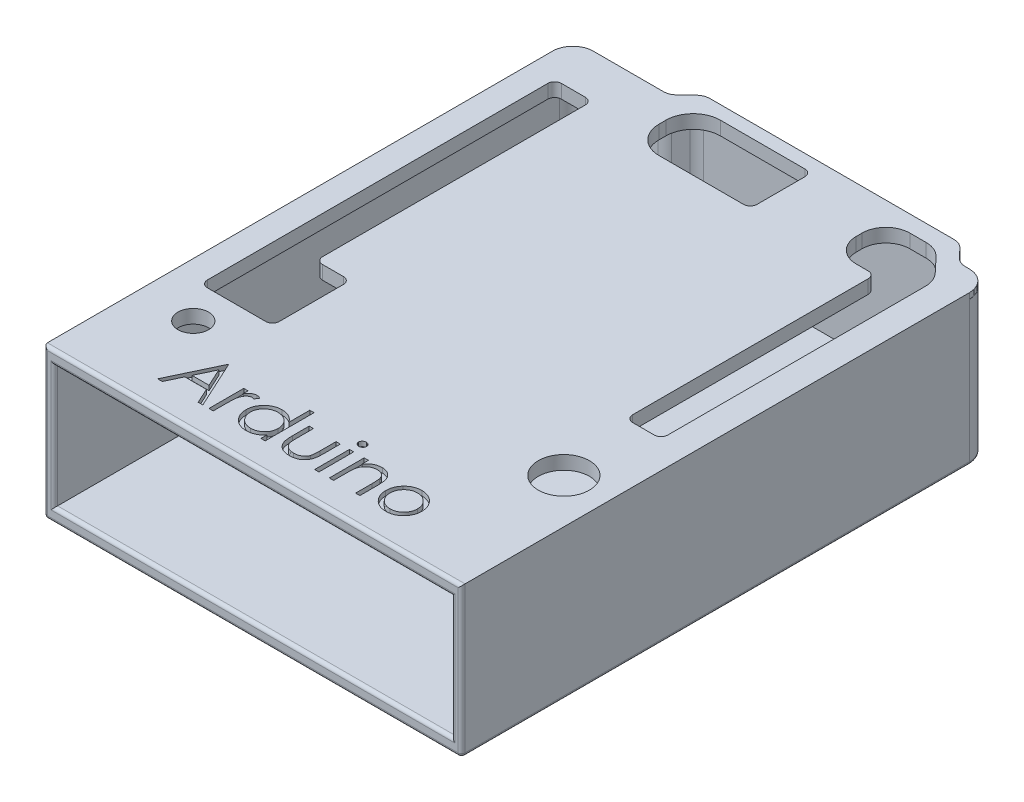
from build123d import *
from build123d.topology import SkipClean

# Parameters (mm, degrees)
SKETCH1_W                = 70
SKETCH1_H                = 100
BOSS_EXTRUDE1_DEPTH      = 2
CUT_EXTRUDE1_DEPTH       = 10
SKETCH3_W                = 95.720729794
SKETCH3_H                = 12.847627562
CUT_EXTRUDE2_DEPTH       = 10
CUT_EXTRUDE3_DEPTH       = 10
SKETCH5_R                = 2.00093218
CUT_EXTRUDE4_DEPTH       = 10
BOSS_EXTRUDE2_START      = 4.5
SKETCH6_R                = 2.75
SKETCH6_R_2              = 2.00093218
BOSS_EXTRUDE2_DEPTH      = 4.5
BOSS_EXTRUDE3_DEPTH      = 15
BOSS_EXTRUDE3_DEPTH_BACK = 6.5
SKETCH7_W                = 58.34
SKETCH7_H                = 1.5
SKETCH8_W                = 1.5
SKETCH8_H                = 75.08
BOSS_EXTRUDE4_DEPTH      = 22
CUT_EXTRUDE5_DEPTH       = 42
CUT_EXTRUDE5_DEPTH_BACK  = 62
SKETCH9_W                = 84.196128198
SKETCH9_H                = 17.321182881
FILLET1_R                = 3
CUT_EXTRUDE7_DEPTH       = 62
CUT_EXTRUDE8_DEPTH       = 62
SKETCH12_W               = 61.34
SKETCH12_H               = 7.216210766
BOSS_EXTRUDE5_DEPTH      = 2
SKETCH13_W               = 1.5
SKETCH13_H               = 5.140412553
BOSS_EXTRUDE6_DEPTH      = 22
BOSS_EXTRUDE7_DEPTH      = 22
BOSS_EXTRUDE9_DEPTH      = 32
BOSS_EXTRUDE9_DEPTH_BACK = 2
CUT_EXTRUDE9_DEPTH       = 32
CUT_EXTRUDE9_DEPTH_BACK  = 42
FILLET2_R                = 3
FILLET3_R                = 2
BOSS_EXTRUDE10_START     = 22
BOSS_EXTRUDE10_DEPTH     = 2
FILLET5_R                = 0.5
CUT_EXTRUDE10_START      = 30
CUT_EXTRUDE10_DEPTH      = 15
CUT_EXTRUDE11_START      = 30
CUT_EXTRUDE11_DEPTH      = 15
CUT_EXTRUDE12_DEPTH      = 5
CUT_EXTRUDE13_START      = 30
SKETCH21_R               = 2.248872427
CUT_EXTRUDE13_DEPTH      = 15
SKETCH23_W               = 0.628205129
SKETCH23_H               = 5.115384616
CUT_EXTRUDE15_DEPTH      = 0.7
SKETCH24_R               = 3.754629605
CUT_EXTRUDE16_DEPTH      = 10.7


with BuildPart() as part:
    # Sketch1 → Boss-Extrude1 (new body)
    with BuildSketch(Plane(origin=(0, 0, 0), x_dir=(1, 0, 0), z_dir=(0, 1, 0))):
        Rectangle(SKETCH1_W, SKETCH1_H)
    extrude(amount=BOSS_EXTRUDE1_DEPTH)

    # Sketch2 → Cut-Extrude1 (cut)
    with BuildSketch(Plane(origin=(0, 2, 0), x_dir=(1, 0, 0), z_dir=(0, 1, 0))):
        Polygon((-33.072602728, 52.88112647), (-33.072602728, -56.272918838), (-47.795006236, -51.658189727), (-45.784277592, 52.88112647), align=None)
    extrude(amount=-CUT_EXTRUDE1_DEPTH, mode=Mode.SUBTRACT)

    # Sketch3 → Cut-Extrude2 (cut)
    with BuildSketch(Plane(origin=(0, 2, 0), x_dir=(1, 0, 0), z_dir=(0, 1, 0))):
        with Locations((5.920987425, 50.875958017)):
            Rectangle(SKETCH3_W, SKETCH3_H)
    extrude(amount=-CUT_EXTRUDE2_DEPTH, mode=Mode.SUBTRACT)

    # Sketch4 → Cut-Extrude3 (cut)
    with BuildSketch(Plane(origin=(0, 2, 0), x_dir=(1, 0, 0), z_dir=(0, 1, 0))):
        Polygon((25.267397272, 48.370213431), (25.267397272, -29.127855764), (-38.623816474, -29.127855764), (-38.623816474, -57.765260511), (46.074609036, -57.765260511), (46.074609036, 51.678745677), (25.267397272, 51.678745677), align=None)
    extrude(amount=-CUT_EXTRUDE3_DEPTH, mode=Mode.SUBTRACT)

    # Sketch5 → Cut-Extrude4 (cut)
    with BuildSketch(Plane(origin=(0, 2, 0), x_dir=(1, 0, 0), z_dir=(0, 1, 0))):
        with Locations((-12.792602728, 39.412144236)):
            Circle(SKETCH5_R)
        with Locations((15.147397272, 39.412144236)):
            Circle(SKETCH5_R)
        with Locations((-28.032602728, -11.387855764)):
            Circle(SKETCH5_R)
        with Locations((20.227397272, -12.657855764)):
            Circle(SKETCH5_R)
    extrude(amount=-CUT_EXTRUDE4_DEPTH, mode=Mode.SUBTRACT)

    # Sketch6 → Boss-Extrude2 (add)
    # profile 1 of 4: a face of its own
    with BuildSketch(Plane(origin=(0, 0, 0), x_dir=(1, 0, 0), z_dir=(0, 1, 0)).offset(BOSS_EXTRUDE2_START)):
        with Locations((-12.792602728, 39.412144236)):
            Circle(SKETCH6_R)
        with Locations((-12.792602728, 39.412144236)):
            Circle(SKETCH6_R_2, mode=Mode.SUBTRACT)
    # profile 2 of 4: a face of its own
    with BuildSketch(Plane(origin=(0, 0, 0), x_dir=(1, 0, 0), z_dir=(0, 1, 0)).offset(BOSS_EXTRUDE2_START)):
        with Locations((15.147397272, 39.412144236)):
            Circle(SKETCH6_R)
        with Locations((15.147397272, 39.412144236)):
            Circle(SKETCH6_R_2, mode=Mode.SUBTRACT)
    # profile 3 of 4: a face of its own
    with BuildSketch(Plane(origin=(0, 0, 0), x_dir=(1, 0, 0), z_dir=(0, 1, 0)).offset(BOSS_EXTRUDE2_START)):
        with Locations((20.227397272, -12.657855764)):
            Circle(SKETCH6_R)
        with Locations((20.227397272, -12.657855764)):
            Circle(SKETCH6_R_2, mode=Mode.SUBTRACT)
    # profile 4 of 4: a face of its own
    with BuildSketch(Plane(origin=(0, 0, 0), x_dir=(1, 0, 0), z_dir=(0, 1, 0)).offset(BOSS_EXTRUDE2_START)):
        with Locations((-28.032602728, -11.387855764)):
            Circle(SKETCH6_R)
        with Locations((-28.032602728, -11.387855764)):
            Circle(SKETCH6_R_2, mode=Mode.SUBTRACT)
    extrude(amount=-BOSS_EXTRUDE2_DEPTH)



with BuildPart() as body_2:
    # Sketch7 → Boss-Extrude3 (new, two sides: drawn at the far end of the back side and taken through both)
    with BuildSketch(Plane(origin=(22.767397272, 6.15, 26.627855764), x_dir=(1, 0, 0), z_dir=(0, 1, 0)).offset(-BOSS_EXTRUDE3_DEPTH_BACK)):
        with Locations((-26.67, 71.83)):
            Rectangle(SKETCH7_W, SKETCH7_H)
    extrude(amount=BOSS_EXTRUDE3_DEPTH + BOSS_EXTRUDE3_DEPTH_BACK)


with BuildPart() as part_1:
    add(part.part)

    add(body_2.part)  # Boss-Extrude4 merges body 2
    # Sketch8 → Boss-Extrude4 (add)
    with BuildSketch(Plane(origin=(0, 0, 0), x_dir=(1, 0, 0), z_dir=(0, 1, 0))):
        with Locations((-33.822602728, 8.412144236)):
            Rectangle(SKETCH8_W, SKETCH8_H)
        with Locations((26.017397272, 8.412144236)):
            Rectangle(SKETCH8_W, SKETCH8_H)
    extrude(amount=BOSS_EXTRUDE4_DEPTH)

    # Sketch9 → Cut-Extrude5 (cut, two sides: drawn at the far end of the back side and taken through both)
    with BuildSketch(Plane(origin=(0, 0, 0), x_dir=(0, 0, -1), z_dir=(1, 0, 0)).offset(-CUT_EXTRUDE5_DEPTH_BACK)):
        Polygon((-29.127855764, 0), (47.696021269, 0), (47.696021269, -7.078355993), (-35.989739634, -7.078355993), (-35.989739634, 0), align=None)
        with Locations((3.854080137, 29.810591441)):
            Rectangle(SKETCH9_W, SKETCH9_H)
    extrude(amount=CUT_EXTRUDE5_DEPTH + CUT_EXTRUDE5_DEPTH_BACK, mode=Mode.SUBTRACT)

    # Fillet1
    fillet1_edges = [part_1.edges().sort_by_distance(p)[0] for p in [
        (-34.572602728, 10.575, -45.952144236),
        (26.767397272, 10.575, -45.952144236),
    ]]
    fillet(fillet1_edges, radius=FILLET1_R)

    # Sketch10 → Cut-Extrude7 (cut)
    with BuildSketch(Plane(origin=(0, 0, 0), x_dir=(1, 0, 0), z_dir=(0, 1, 0))):
        Polygon((-36.424160263, 41.912144236), (-19.770266135, 41.912144236), (-13.434407826, 48.248002545), (-36.424160263, 48.248002545), align=None)
    extrude(amount=CUT_EXTRUDE7_DEPTH, mode=Mode.SUBTRACT)

    # Sketch11 → Cut-Extrude8 (cut)
    with BuildSketch(Plane(origin=(0, 0, 0), x_dir=(1, 0, 0), z_dir=(0, 1, 0))):
        Polygon((15.510553933, 47.664521482), (21.34510981, 41.829965605), (28.53169084, 41.829965605), (28.53169084, 49.486163189), align=None)
    extrude(amount=CUT_EXTRUDE8_DEPTH, mode=Mode.SUBTRACT)

    # Sketch12 → Boss-Extrude5 (add)
    with BuildSketch(Plane(origin=(0, 0, 0), x_dir=(1, 0, 0), z_dir=(0, 1, 0))):
        with Locations((-3.902602728, -30.660162934)):
            Rectangle(SKETCH12_W, SKETCH12_H)
    extrude(amount=BOSS_EXTRUDE5_DEPTH)

    # Sketch13 → Boss-Extrude6 (add)
    with BuildSketch(Plane(origin=(0, 0, 0), x_dir=(1, 0, 0), z_dir=(0, 1, 0))):
        with Locations((-33.822602728, -31.698062041)):
            Rectangle(SKETCH13_W, SKETCH13_H)
        with Locations((26.017397272, -31.698062041)):
            Rectangle(SKETCH13_W, SKETCH13_H)
    extrude(amount=BOSS_EXTRUDE6_DEPTH)

    # Sketch14 → Boss-Extrude7 (add)
    with BuildSketch(Plane(origin=(0, 0, 0), x_dir=(1, 0, 0), z_dir=(0, 1, 0))):
        Polygon((-34.572602728, 41.912144236), (-19.770266135, 41.912144236), (-15.730266135, 45.952144236), (-17.851586478, 45.952144236), (-20.391586478, 43.412144236), (-34.572602728, 43.412144236), align=None)
    extrude(amount=BOSS_EXTRUDE7_DEPTH)

    # Sketch15 → Boss-Extrude9 (add, two sides: drawn at the far end of the back side and taken through both)
    with BuildSketch(Plane(origin=(0, 2, 0), x_dir=(1, 0, 0), z_dir=(0, 1, 0)).offset(-BOSS_EXTRUDE9_DEPTH_BACK)):
        Polygon((17.222931178, 45.952144236), (19.76177089, 45.952144236), (22.2501255, 43.329965605), (26.767397272, 43.329965605), (26.767397272, 41.829965605), (21.34510981, 41.829965605), align=None)
    extrude(amount=BOSS_EXTRUDE9_DEPTH + BOSS_EXTRUDE9_DEPTH_BACK)

    # Sketch16 → Cut-Extrude9 (cut, two sides: drawn at the far end of the back side and taken through both)
    with BuildSketch(Plane(origin=(0, 0, 0), x_dir=(0, 0, -1), z_dir=(1, 0, 0)).offset(-CUT_EXTRUDE9_DEPTH_BACK)):
        Polygon((-28.038160709, 21.15), (-36.945423255, 21.15), (-36.945423255, 45.772000337), (52.018542941, 45.772000337), (52.018542941, 21.15), align=None)
    extrude(amount=CUT_EXTRUDE9_DEPTH + CUT_EXTRUDE9_DEPTH_BACK, mode=Mode.SUBTRACT)

    # Fillet2
    fillet2_edges = [part_1.edges().sort_by_distance(p)[0] for p in [
        (26.767397272, 10.575, -43.329965605),
        (-34.572602728, 10.575, -43.412144236),
    ]]
    fillet(fillet2_edges, radius=FILLET2_R)

    # Fillet3
    fillet3_edges = [part_1.edges().sort_by_distance(p)[0] for p in [
        (25.267397272, 11.575, -41.829965605),
        (21.34510981, 11.575, -41.829965605),
        (22.2501255, 10.575, -43.329965605),
        (19.76177089, 10.575, -45.952144236),
        (-17.851586478, 10.575, -45.952144236),
        (-17.230266135, 11.575, -44.452144236),
        (-33.072602728, 11.575, -41.912144236),
        (-19.770266135, 11.575, -41.912144236),
        (-20.391586478, 10.575, -43.412144236),
    ]]
    fillet(fillet3_edges, radius=FILLET3_R)

    # Sketch17 → Boss-Extrude10 (add)
    with SkipClean():  # the faces are left unmerged after this step: merging them gives an invalid solid
        with BuildSketch(Plane(origin=(0, 0, 0), x_dir=(1, 0, 0), z_dir=(0, 1, 0)).offset(BOSS_EXTRUDE10_START)):
            with BuildLine():
                Line((-34.572602728, -34.268268317), (-34.572602728, 40.412144236))
                ThreePointArc((-34.572602728, 40.412144236), (-33.693923072, 42.53346458), (-31.572602728, 43.412144236))
                Line((-31.572602728, 43.412144236), (-21.220013603, 43.412144236))
                Line((-21.220013603, 43.412144236), (-20.701879514, 43.480425555))
                Line((-20.701879514, 43.480425555), (-20.220013603, 43.680093429))
                Line((-20.220013603, 43.680093429), (-18.437372916, 45.366357799))
                Line((-18.437372916, 45.366357799), (-18.023455535, 45.68402401))
                Line((-18.023455535, 45.68402401), (-17.540963094, 45.883951496))
                Line((-17.540963094, 45.883951496), (-17.023159353, 45.952144236))
                Line((-17.023159353, 45.952144236), (18.902503078, 45.952144236))
                Line((18.902503078, 45.952144236), (19.307629674, 45.91068258))
                Line((19.307629674, 45.91068258), (19.691990791, 45.789726657))
                Line((19.691990791, 45.789726657), (20.050310815, 45.589989589))
                Line((20.050310815, 45.589989589), (20.35325182, 45.328853388))
                Line((20.35325182, 45.328853388), (21.658644569, 43.953256453))
                Line((21.658644569, 43.953256453), (21.964086629, 43.690370349))
                Line((21.964086629, 43.690370349), (22.319905599, 43.492383184))
                Line((22.319905599, 43.492383184), (22.706506422, 43.37096531))
                Line((22.706506422, 43.37096531), (23.109393311, 43.329965605))
                Line((23.109393311, 43.329965605), (23.767397272, 43.329965605))
                Line((23.767397272, 43.329965605), (24.544750646, 43.227502788))
                Line((24.544750646, 43.227502788), (25.267397272, 42.928041816))
                Line((25.267397272, 42.928041816), (25.888717616, 42.451285948))
                Line((25.888717616, 42.451285948), (26.365216932, 41.830409877))
                Line((26.365216932, 41.830409877), (26.665108161, 41.106671216))
                Line((26.665108161, 41.106671216), (26.767397272, 40.329965605))
                Line((26.767397272, 40.329965605), (26.767397272, -34.268268317))
                Line((26.767397272, -34.268268317), (-34.572602728, -34.268268317))
            make_face()
        extrude(amount=-BOSS_EXTRUDE10_DEPTH)
    add(part_1.part.scale(1), mode=Mode.REPLACE)  # the faces are merged on a copy

    # Fillet5
    fillet5_edges = [part_1.edges().sort_by_distance(p)[0] for p in [
        (-34.572602728, 0, -3.07193796),
        (-33.693923072, 0, -42.53346458),
        (-26.396308166, 0, -43.412144236),
        (-20.454646738, 0, -43.564385171),
        (-19.121586478, 0, -44.682144236),
        (-17.788526218, 0, -45.799903302),
        (0.939671862, 0, -45.952144236),
        (19.691990791, 0, -45.789726657),
        (21.005948195, 0, -44.641054921),
        (22.319905599, 0, -43.492383184),
        (23.438395292, 0, -43.329965605),
        (25.888717616, 0, -42.451285948),
        (26.767397272, 0, -3.030848644),
        (-3.902602728, 0, 34.268268317),
        (25.267397272, 11, 34.268268317),
        (-3.902602728, 2, 34.268268317),
        (-33.072602728, 11, 34.268268317),
        (-3.902602728, 20, 34.268268317),
        (26.767397272, 11, 34.268268317),
        (-34.572602728, 11, 34.268268317),
        (-3.902602728, 22, 34.268268317),
    ]]
    fillet(fillet5_edges, radius=FILLET5_R)

    # Sketch18 → Cut-Extrude10 (cut)
    with BuildSketch(Plane(origin=(0, 0, 0), x_dir=(1, 0, 0), z_dir=(0, 1, 0)).offset(CUT_EXTRUDE10_START)):
        with BuildLine():
            Line((-29.810553916, 36.96650048), (-26.310553916, 36.96650048))
            ThreePointArc((-26.310553916, 36.96650048), (-25.603447135, 36.673607261), (-25.310553916, 35.96650048))
            Line((-25.310553916, 35.96650048), (-25.310553916, -2.608939995))
            ThreePointArc((-25.310553916, -2.608939995), (-25.017660697, -3.316046777), (-24.310553916, -3.608939995))
            Line((-24.310553916, -3.608939995), (-21.245586509, -3.608939995))
            ThreePointArc((-21.245586509, -3.608939995), (-20.538479728, -3.901833214), (-20.245586509, -4.608939995))
            Line((-20.245586509, -4.608939995), (-20.245586509, -14.03349952))
            ThreePointArc((-20.245586509, -14.03349952), (-20.538479728, -14.740606301), (-21.245586509, -15.03349952))
            Line((-21.245586509, -15.03349952), (-25.310553916, -15.03349952))
            Line((-25.310553916, -15.03349952), (-29.810553916, -15.03349952))
            ThreePointArc((-29.810553916, -15.03349952), (-30.517660697, -14.740606301), (-30.810553916, -14.03349952))
            Line((-30.810553916, -14.03349952), (-30.810553916, 35.96650048))
            ThreePointArc((-30.810553916, 35.96650048), (-30.517660697, 36.673607261), (-29.810553916, 36.96650048))
        make_face()
    extrude(amount=-CUT_EXTRUDE10_DEPTH, mode=Mode.SUBTRACT)

    # Sketch19 → Cut-Extrude11 (cut)
    with BuildSketch(Plane(origin=(0, 0, 0), x_dir=(1, 0, 0), z_dir=(0, 1, 0)).offset(CUT_EXTRUDE11_START)):
        with BuildLine():
            Line((-17.464077717, 39.965619025), (-17.464077717, 38.953894265))
            ThreePointArc((-17.464077717, 38.953894265), (-16.292504842, 36.12546714), (-13.464077717, 34.953894265))
            Line((-13.464077717, 34.953894265), (-1.058382216, 34.953894265))
            ThreePointArc((-1.058382216, 34.953894265), (-0.351275434, 35.246787484), (-0.058382216, 35.953894265))
            Line((-0.058382216, 35.953894265), (-0.058382216, 42.965619025))
            ThreePointArc((-0.058382216, 42.965619025), (-0.351275434, 43.672725806), (-1.058382216, 43.965619025))
            Line((-1.058382216, 43.965619025), (-13.464077717, 43.965619025))
            ThreePointArc((-13.464077717, 43.965619025), (-16.292504842, 42.79404615), (-17.464077717, 39.965619025))
        make_face()
    extrude(amount=-CUT_EXTRUDE11_DEPTH, mode=Mode.SUBTRACT)

    # Sketch20 → Cut-Extrude12 (cut)
    with BuildSketch(Plane(origin=(0, 22, 0), x_dir=(1, 0, 0), z_dir=(0, 1, 0))):
        with BuildLine():
            Line((22.726176419, 37.882930174), (22.726176419, 0.059695409))
            ThreePointArc((22.726176419, 0.059695409), (22.433283201, -0.647411372), (21.726176419, -0.940304591))
            Line((21.726176419, -0.940304591), (18.56215784, -0.940304591))
            ThreePointArc((18.56215784, -0.940304591), (17.855051059, -0.647411372), (17.56215784, 0.059695409))
            Line((17.56215784, 0.059695409), (17.56215784, 34.64497476))
            ThreePointArc((17.56215784, 34.64497476), (17.269264621, 35.352081541), (16.56215784, 35.64497476))
            Line((16.56215784, 35.64497476), (14.802122901, 35.64497476))
            ThreePointArc((14.802122901, 35.64497476), (12.327249167, 36.670101026), (11.302122901, 39.14497476))
            Line((11.302122901, 39.14497476), (11.302122901, 40.019076515))
            ThreePointArc((11.302122901, 40.019076515), (12.327249167, 42.493950249), (14.802122901, 43.519076515))
            Line((14.802122901, 43.519076515), (17.213816674, 43.519076515))
            ThreePointArc((17.213816674, 43.519076515), (18.601286721, 43.232318938), (19.761403883, 42.419034725))
            Line((19.761403883, 42.419034725), (21.773763629, 40.282888384))
            ThreePointArc((21.773763629, 40.282888384), (22.479371405, 39.173946202), (22.726176419, 37.882930174))
        make_face()
    extrude(amount=-CUT_EXTRUDE12_DEPTH, mode=Mode.SUBTRACT)

    # Sketch21 → Cut-Extrude13 (cut)
    with BuildSketch(Plane(origin=(0, 0, 0), x_dir=(1, 0, 0), z_dir=(0, 1, 0)).offset(CUT_EXTRUDE13_START)):
        with Locations((-26.635602728, -20.277855764)):
            Circle(SKETCH21_R)
    extrude(amount=-CUT_EXTRUDE13_DEPTH, mode=Mode.SUBTRACT)

    # Sketch23 → Cut-Extrude15 (cut)
    # profile 1 of 8: a face of its own
    with BuildSketch(Plane(origin=(0, 22, 0), x_dir=(1, 0, 0), z_dir=(0, 1, 0))):
        Polygon((-18.477923446, -23.265508505), (-15.247154216, -30.265508505), (-15.930046844, -30.265508505), (-16.964902613, -28.021918761), (-20.138179857, -28.021918761), (-21.202482741, -30.265508505), (-21.888179857, -30.265508505), (-18.567667036, -23.265508505), align=None)
        Polygon((-18.529806459, -24.629891518), (-19.797434664, -27.303970043), (-17.2958321, -27.303970043), align=None, mode=Mode.SUBTRACT)
    # profile 2 of 8: a face of its own
    with BuildSketch(Plane(origin=(0, 22, 0), x_dir=(1, 0, 0), z_dir=(0, 1, 0))):
        with BuildLine():
            Line((-14.349718318, -25.150123889), (-13.72151319, -25.150123889))
            Line((-13.72151319, -25.150123889), (-13.72151319, -25.903128697))
            add(Edge.make_bspline(
                [(-13.72151319, -25.903128697), (-13.675135673, -25.83301704), (-13.586439031, -25.698929042), (-13.439013172, -25.52159044), (-13.288006509, -25.374760347), (-13.132696135, -25.257753309), (-12.971939935, -25.170127071), (-12.809266032, -25.105941001), (-12.642115092, -25.067986371), (-12.529791243, -25.062919053), (-12.473516395, -25.0603803)],
                knots=[0, 0, 0, 0, 1.2804753, 2.448899062, 3.506932113, 4.484331642, 5.4025378, 6.288909075, 7.142734305, 8, 8, 8, 8], degree=3))
            add(Edge.make_bspline(
                [(-12.473516395, -25.0603803), (-12.429863742, -25.062761353), (-12.340045572, -25.067660524), (-12.204080392, -25.102082174), (-12.063993488, -25.157038219), (-11.973708714, -25.208718664), (-11.926641395, -25.235660748)],
                knots=[0, 0, 0, 0, 0.901110191, 1.854092781, 2.881294221, 4, 4, 4, 4], degree=3))
            Line((-11.926641395, -25.235660748), (-12.271593318, -25.779731261))
            add(Edge.make_bspline(
                [(-12.271593318, -25.779731261), (-12.301811361, -25.766250729), (-12.35917099, -25.740662098), (-12.443080122, -25.710378078), (-12.520442796, -25.692546246), (-12.569729912, -25.689844811), (-12.5927071, -25.688585428)],
                knots=[0, 0, 0, 0, 1.180555205, 2.24091978, 3.179933427, 4, 4, 4, 4], degree=3))
            add(Edge.make_bspline(
                [(-12.5927071, -25.688585428), (-12.643118567, -25.691945503), (-12.745943347, -25.698799081), (-12.896912346, -25.752676697), (-13.043406757, -25.839727177), (-13.159750082, -25.9362694), (-13.249834587, -26.029364995), (-13.314115039, -26.110661801), (-13.373080532, -26.201819064), (-13.429420973, -26.301278431), (-13.480753562, -26.410738123), (-13.5286629, -26.52910455), (-13.571980626, -26.656514808), (-13.596681114, -26.745279848), (-13.609333703, -26.790748889)],
                knots=[0, 0, 0, 0, 1.125678352, 2.296057538, 3.5422874, 4.923748041, 5.663163013, 6.437101912, 7.23742474, 8.08941207, 8.991984279, 9.93940061, 10.944477711, 12, 12, 12, 12], degree=3))
            add(Edge.make_bspline(
                [(-13.609333703, -26.790748889), (-13.61879849, -26.831303237), (-13.639762273, -26.921128034), (-13.660145349, -27.071825083), (-13.680284385, -27.249872401), (-13.694477621, -27.455765587), (-13.707633706, -27.688990474), (-13.71505387, -27.949902366), (-13.721260151, -28.238769068), (-13.721426285, -28.440717774), (-13.72151319, -28.546357864)],
                knots=[0, 0, 0, 0, 0.566838948, 1.255505196, 2.06880316, 3.007127437, 4.065329342, 5.249902469, 6.561414163, 8, 8, 8, 8], degree=3))
            Line((-13.72151319, -28.546357864), (-13.72151319, -30.265508505))
            Line((-13.72151319, -30.265508505), (-14.349718318, -30.265508505))
            Line((-14.349718318, -30.265508505), (-14.349718318, -25.150123889))
        make_face()
    # profile 3 of 8: a face of its own
    with BuildSketch(Plane(origin=(0, 22, 0), x_dir=(1, 0, 0), z_dir=(0, 1, 0))):
        with BuildLine():
            Line((-6.093308062, -23.086021325), (-6.093308062, -30.265508505))
            Line((-6.093308062, -30.265508505), (-6.72151319, -30.265508505))
            Line((-6.72151319, -30.265508505), (-6.72151319, -29.3806928))
            add(Edge.make_bspline(
                [(-6.72151319, -29.3806928), (-6.792350771, -29.460771988), (-6.930591202, -29.61704753), (-7.161473438, -29.821211875), (-7.406209794, -29.989968518), (-7.663612436, -30.126268349), (-7.933448923, -30.228652462), (-8.215121097, -30.30142478), (-8.508743859, -30.34821245), (-8.709248568, -30.352884494), (-8.810856139, -30.355252094)],
                knots=[0, 0, 0, 0, 1.074387032, 2.096679803, 3.090159297, 4.057316773, 5.018401886, 5.985159533, 6.978961417, 8, 8, 8, 8], degree=3))
            add(Edge.make_bspline(
                [(-8.810856139, -30.355252094), (-8.901192046, -30.35279935), (-9.079338456, -30.347962429), (-9.34139661, -30.310437822), (-9.593581109, -30.250176579), (-9.836130255, -30.1663748), (-10.067474546, -30.055213156), (-10.289594739, -29.92213066), (-10.501340123, -29.763649), (-10.699483201, -29.582472943), (-10.881947202, -29.385682969), (-11.042069747, -29.175791875), (-11.175575907, -28.953707267), (-11.287216068, -28.72224096), (-11.373208757, -28.479611121), (-11.433156025, -28.226656785), (-11.470636919, -27.963677038), (-11.47547184, -27.784597991), (-11.477923446, -27.693793761)],
                knots=[0, 0, 0, 0, 1.033919861, 2.038935746, 3.024066025, 3.998881131, 4.97069526, 5.957263378, 6.95902576, 7.993208707, 9.027059324, 10.027763471, 11.009749337, 11.988697705, 12.965288445, 13.950418724, 14.960734635, 16, 16, 16, 16], degree=3))
            add(Edge.make_bspline(
                [(-11.477923446, -27.693793761), (-11.475417504, -27.604866354), (-11.47046339, -27.429061667), (-11.43355695, -27.170504271), (-11.371494933, -26.92146775), (-11.284399238, -26.682753863), (-11.172715328, -26.454073763), (-11.036859154, -26.235265713), (-10.876820904, -26.025726918), (-10.69231609, -25.830384465), (-10.49244655, -25.649943236), (-10.278629088, -25.493125145), (-10.056182525, -25.357691448), (-9.821656504, -25.250384495), (-9.578522295, -25.163566286), (-9.324615403, -25.10350035), (-9.060992246, -25.068105707), (-8.882011262, -25.062980179), (-8.791224728, -25.0603803)],
                knots=[0, 0, 0, 0, 1.020392517, 2.01726096, 2.990465484, 3.961182959, 4.928053699, 5.906110375, 6.912531644, 7.948652711, 8.985773172, 9.998621852, 10.987621588, 11.969261332, 12.953316658, 13.946091881, 14.958173133, 16, 16, 16, 16], degree=3))
            add(Edge.make_bspline(
                [(-8.791224728, -25.0603803), (-8.686791113, -25.063514492), (-8.481799532, -25.069666562), (-8.182002489, -25.121079296), (-7.898427268, -25.207405052), (-7.629441293, -25.325587615), (-7.376648172, -25.479189117), (-7.138194891, -25.664692013), (-6.918228245, -25.887346305), (-6.7880846, -26.054569452), (-6.72151319, -26.140107864)],
                knots=[0, 0, 0, 0, 1.031072012, 2.023879775, 2.993683497, 3.952812103, 4.918022106, 5.908088563, 6.929940113, 8, 8, 8, 8], degree=3))
            Line((-6.72151319, -26.140107864), (-6.72151319, -23.086021325))
            Line((-6.72151319, -23.086021325), (-6.093308062, -23.086021325))
        make_face()
        with BuildLine():
            add(Edge.make_bspline(
                [(-8.782811267, -25.688585428), (-8.874639943, -25.691852703), (-9.055895143, -25.698301785), (-9.321983147, -25.748648776), (-9.576609975, -25.832417964), (-9.818502123, -25.946981767), (-10.043838557, -26.09103924), (-10.245225898, -26.265282007), (-10.424311301, -26.464956035), (-10.57492783, -26.689160256), (-10.697708823, -26.929516438), (-10.784042887, -27.180765314), (-10.840981382, -27.438375269), (-10.846798423, -27.613100641), (-10.849718318, -27.700804979)],
                knots=[0, 0, 0, 0, 1.031046209, 2.035121221, 3.029706178, 4.034933723, 5.034054252, 6.02443088, 7.017295772, 8.038157696, 9.050218397, 10.03989886, 11.016116709, 12, 12, 12, 12], degree=3))
            add(Edge.make_bspline(
                [(-10.849718318, -27.700804979), (-10.845988532, -27.787985193), (-10.838543578, -27.962003905), (-10.785042189, -28.219965059), (-10.695282442, -28.471273143), (-10.572798317, -28.71379513), (-10.419425067, -28.938963331), (-10.241647762, -29.142443576), (-10.0377472, -29.317422752), (-9.811892185, -29.4638979), (-9.570676245, -29.582222941), (-9.317008382, -29.66455422), (-9.055657105, -29.717709782), (-8.877952438, -29.723918735), (-8.788420241, -29.727046966)],
                knots=[0, 0, 0, 0, 0.979072187, 1.954306742, 2.945804271, 3.96968567, 4.997920485, 5.998718438, 6.996577872, 8.005894225, 9.015743152, 10.005417472, 10.995077863, 12, 12, 12, 12], degree=3))
            add(Edge.make_bspline(
                [(-8.788420241, -29.727046966), (-8.697527236, -29.723727038), (-8.516750063, -29.717124031), (-8.249872647, -29.666561501), (-7.990882721, -29.583023904), (-7.743308265, -29.46722565), (-7.512676002, -29.323710939), (-7.305680247, -29.155696757), (-7.13064831, -28.960290388), (-6.982263091, -28.745537482), (-6.865912258, -28.510113489), (-6.781160139, -28.259445108), (-6.731052328, -27.993523612), (-6.724736869, -27.811795758), (-6.72151319, -27.719034146)],
                knots=[0, 0, 0, 0, 1.01762866, 2.023962475, 3.030623092, 4.058876274, 5.077231937, 6.066672613, 7.034107872, 8.005628644, 8.981990164, 9.965428785, 10.961468474, 12, 12, 12, 12], degree=3))
            add(Edge.make_bspline(
                [(-6.72151319, -27.719034146), (-6.723432503, -27.648358485), (-6.727210318, -27.509246418), (-6.756071457, -27.304991383), (-6.80198131, -27.109523931), (-6.86667365, -26.922638553), (-6.951656218, -26.745368522), (-7.05415175, -26.576441002), (-7.17596265, -26.416734579), (-7.315128042, -26.268448437), (-7.467458447, -26.133195512), (-7.628647528, -26.012467031), (-7.800605022, -25.913289485), (-7.980439096, -25.831206942), (-8.168461765, -25.765888643), (-8.366203004, -25.722313255), (-8.571560978, -25.692392613), (-8.711653089, -25.689867851), (-8.782811267, -25.688585428)],
                knots=[0, 0, 0, 0, 1.050140795, 2.067009409, 3.05949893, 4.030605086, 5.00011959, 5.97591094, 6.962425594, 7.979863591, 8.993523472, 9.986985069, 10.967611495, 11.937549037, 12.921786183, 13.919465291, 14.943216303, 16, 16, 16, 16], degree=3))
        make_face(mode=Mode.SUBTRACT)
    # profile 4 of 8: a face of its own
    with BuildSketch(Plane(origin=(0, 22, 0), x_dir=(1, 0, 0), z_dir=(0, 1, 0))):
        with BuildLine():
            Line((-4.747154216, -25.150123889), (-4.118949087, -25.150123889))
            Line((-4.118949087, -25.150123889), (-4.118949087, -27.522720043))
            add(Edge.make_bspline(
                [(-4.118949087, -27.522720043), (-4.118665278, -27.592365542), (-4.118122363, -27.725594118), (-4.114440481, -27.917304491), (-4.105780294, -28.092137916), (-4.094952645, -28.25019539), (-4.081028372, -28.391450173), (-4.064461651, -28.515408887), (-4.045944808, -28.623477255), (-4.02781938, -28.688563967), (-4.019389793, -28.718833825)],
                knots=[0, 0, 0, 0, 1.388932606, 2.656963016, 3.823490214, 4.879454478, 5.816252168, 6.653371382, 7.373723809, 8, 8, 8, 8], degree=3))
            add(Edge.make_bspline(
                [(-4.019389793, -28.718833825), (-4.005866883, -28.756879567), (-3.979102201, -28.832180089), (-3.930555233, -28.9409581), (-3.87049856, -29.041708665), (-3.804778904, -29.13831681), (-3.728980089, -29.227920784), (-3.644061147, -29.310369271), (-3.552864673, -29.388777454), (-3.417354626, -29.481547038), (-3.232036094, -29.580977698), (-2.988730583, -29.666769335), (-2.724922131, -29.718040975), (-2.542592693, -29.723989485), (-2.448876972, -29.727046966)],
                knots=[0, 0, 0, 0, 0.725840625, 1.436591201, 2.137033971, 2.831655856, 3.53531722, 4.242432219, 4.957935707, 5.694543706, 7.190802206, 8.724350549, 10.316345118, 12, 12, 12, 12], degree=3))
            add(Edge.make_bspline(
                [(-2.448876972, -29.727046966), (-2.355169957, -29.723924469), (-2.17386422, -29.717883015), (-1.912954281, -29.668315938), (-1.674451453, -29.585504559), (-1.46074955, -29.469889736), (-1.27281787, -29.32840561), (-1.116209032, -29.162387993), (-0.986994523, -28.977089219), (-0.930575682, -28.838840661), (-0.902202293, -28.769314594)],
                knots=[0, 0, 0, 0, 1.157059328, 2.238695713, 3.266970494, 4.264342957, 5.228770407, 6.160125903, 7.074715775, 8, 8, 8, 8], degree=3))
            add(Edge.make_bspline(
                [(-0.902202293, -28.769314594), (-0.893813832, -28.741381997), (-0.875268996, -28.679629846), (-0.855344293, -28.57487035), (-0.83739537, -28.44994114), (-0.822069017, -28.304024723), (-0.811138692, -28.137502418), (-0.805246639, -27.950426266), (-0.798590088, -27.743383546), (-0.798489056, -27.598448027), (-0.798436267, -27.522720043)],
                knots=[0, 0, 0, 0, 0.557542046, 1.232589297, 2.036731608, 2.971723315, 4.038036528, 5.22795436, 6.551621927, 8, 8, 8, 8], degree=3))
            Line((-0.798436267, -27.522720043), (-0.798436267, -25.150123889))
            Line((-0.798436267, -25.150123889), (-0.170231139, -25.150123889))
            Line((-0.170231139, -25.150123889), (-0.170231139, -27.640508505))
            add(Edge.make_bspline(
                [(-0.170231139, -27.640508505), (-0.171114528, -27.725122848), (-0.172828425, -27.889286247), (-0.183843112, -28.12785447), (-0.202742337, -28.35017896), (-0.231427707, -28.5563774), (-0.265159057, -28.746292363), (-0.308671602, -28.920167255), (-0.360628078, -29.077466363), (-0.419239108, -29.220949917), (-0.488482843, -29.351043705), (-0.562136884, -29.474515339), (-0.647186428, -29.588301209), (-0.736726896, -29.698065483), (-0.836330208, -29.798348538), (-0.944129926, -29.89145149), (-1.058608766, -29.978797553), (-1.182307162, -30.056980112), (-1.313419287, -30.127413403), (-1.452107001, -30.189845559), (-1.600068998, -30.239250713), (-1.755396272, -30.281872045), (-1.91884983, -30.315300983), (-2.090272097, -30.338874117), (-2.269605329, -30.353324778), (-2.391824249, -30.354598868), (-2.454485946, -30.355252094)],
                knots=[0, 0, 0, 0, 1.493040784, 2.896703357, 4.213163133, 5.428574705, 6.569057535, 7.615249723, 8.588095153, 9.490268104, 10.346124644, 11.18633936, 12.024365274, 12.850166724, 13.684164916, 14.514361689, 15.362232829, 16.222528818, 17.093394965, 17.986930858, 18.902426812, 19.842810585, 20.827885679, 21.843828298, 22.894529745, 24, 24, 24, 24], degree=3))
            add(Edge.make_bspline(
                [(-2.454485946, -30.355252094), (-2.516678975, -30.35457268), (-2.638894065, -30.353237568), (-2.818236553, -30.338953952), (-2.990133766, -30.315337611), (-3.153974563, -30.281627176), (-3.309923358, -30.239549037), (-3.458611837, -30.189541966), (-3.598298963, -30.127381002), (-3.730662971, -30.057425887), (-3.854667748, -29.978295336), (-3.970884904, -29.891559257), (-4.079158609, -29.797347131), (-4.179512745, -29.696052417), (-4.270538698, -29.586418544), (-4.353370782, -29.469327423), (-4.429284192, -29.345939246), (-4.497989773, -29.213812921), (-4.557013284, -29.068668902), (-4.609123775, -28.908074707), (-4.651745052, -28.730269674), (-4.686429989, -28.535405817), (-4.71433287, -28.324415734), (-4.733705155, -28.096078903), (-4.744536816, -27.850951519), (-4.746262939, -27.681651739), (-4.747154216, -27.594234466)],
                knots=[0, 0, 0, 0, 1.083640291, 2.129454052, 3.13281866, 4.105697902, 5.042300162, 5.946461698, 6.836384745, 7.703652036, 8.553297018, 9.397182691, 10.228592656, 11.052265423, 11.879314572, 12.708807002, 13.549817954, 14.402308542, 15.300838682, 16.27712199, 17.341985831, 18.484375296, 19.725102775, 21.0496083, 22.476576903, 24, 24, 24, 24], degree=3))
            Line((-4.747154216, -27.594234466), (-4.747154216, -25.150123889))
        make_face()
    # profile 5 of 8: a face of its own
    with BuildSketch(Plane(origin=(0, 22, 0), x_dir=(1, 0, 0), z_dir=(0, 1, 0))):
        with BuildLine():
            add(Edge.make_bspline(
                [(1.487220784, -22.996277736), (1.526203416, -22.99808604), (1.602538896, -23.001627048), (1.712925431, -23.031950003), (1.813439455, -23.083349373), (1.902594921, -23.152308735), (1.979098694, -23.233407622), (2.032660115, -23.327929559), (2.067084907, -23.430046836), (2.071242018, -23.501277015), (2.073358605, -23.537543761)],
                knots=[0, 0, 0, 0, 1.055194115, 2.066272739, 3.074728998, 4.095836921, 5.109056067, 6.073838105, 7.019297344, 8, 8, 8, 8], degree=3))
            add(Edge.make_bspline(
                [(2.073358605, -23.537543761), (2.071194285, -23.572869067), (2.066915681, -23.642703018), (2.032686705, -23.743049962), (1.978642229, -23.836258529), (1.902643978, -23.917199949), (1.813426456, -23.986121189), (1.712928884, -24.037530667), (1.602537987, -24.067850942), (1.526203109, -24.071392319), (1.487220784, -24.073200812)],
                knots=[0, 0, 0, 0, 0.96129708, 1.900370562, 2.859976407, 3.87933698, 4.906634145, 5.921202961, 6.938410037, 8, 8, 8, 8], degree=3))
            add(Edge.make_bspline(
                [(1.487220784, -24.073200812), (1.448684234, -24.071461372), (1.373677874, -24.068075778), (1.264944189, -24.036935743), (1.16528721, -23.986103597), (1.075957865, -23.917651227), (1.001497479, -23.835761432), (0.947300828, -23.743106844), (0.913150904, -23.642688535), (0.908861647, -23.572864203), (0.906691938, -23.537543761)],
                knots=[0, 0, 0, 0, 1.054934014, 2.053291228, 3.073705704, 4.106921865, 5.123545215, 6.088680038, 7.033164197, 8, 8, 8, 8], degree=3))
            add(Edge.make_bspline(
                [(0.906691938, -23.537543761), (0.908814111, -23.501282062), (0.912982194, -23.430061797), (0.947326426, -23.327871731), (1.001046041, -23.233908727), (1.076007168, -23.151857728), (1.165274089, -23.083366859), (1.264947579, -23.032544896), (1.373676978, -23.001402217), (1.44868393, -22.998016988), (1.487220784, -22.996277736)],
                knots=[0, 0, 0, 0, 0.98631895, 1.937192651, 2.907499808, 3.917963147, 4.944918757, 5.95915025, 6.951458133, 8, 8, 8, 8], degree=3))
        make_face()
    # profile 6 of 8: a face of its own
    with BuildSketch(Plane(origin=(0, 22, 0), x_dir=(1, 0, 0), z_dir=(0, 1, 0))):
        with Locations((1.490025271, -27.707816197)):
            Rectangle(SKETCH23_W, SKETCH23_H)
    # profile 7 of 8: a face of its own
    with BuildSketch(Plane(origin=(0, 22, 0), x_dir=(1, 0, 0), z_dir=(0, 1, 0))):
        with BuildLine():
            Line((3.329768861, -25.150123889), (3.957973989, -25.150123889))
            Line((3.957973989, -25.150123889), (3.957973989, -26.072800171))
            add(Edge.make_bspline(
                [(3.957973989, -26.072800171), (4.02504926, -25.989114726), (4.155211162, -25.826720199), (4.371979828, -25.61327905), (4.601067629, -25.4373886), (4.841071636, -25.297181012), (5.092317656, -25.191487759), (5.353274196, -25.115155897), (5.625503608, -25.06938624), (5.810632482, -25.06340578), (5.904288092, -25.0603803)],
                knots=[0, 0, 0, 0, 1.12780773, 2.188550248, 3.19190651, 4.159438251, 5.104880172, 6.052711206, 7.014878035, 8, 8, 8, 8], degree=3))
            add(Edge.make_bspline(
                [(5.904288092, -25.0603803), (5.99894936, -25.06387069), (6.184224296, -25.070702227), (6.453980419, -25.12473561), (6.705927206, -25.21702612), (6.939166318, -25.343450261), (7.149420744, -25.500663207), (7.334070447, -25.683818771), (7.486796942, -25.894490937), (7.589191668, -26.08993725), (7.656642963, -26.263314838), (7.699107638, -26.411808339), (7.735169601, -26.577244641), (7.766433097, -26.759123819), (7.787587321, -26.9587202), (7.804271904, -27.175215584), (7.816229293, -27.408539845), (7.816703707, -27.5699131), (7.816948348, -27.653128697)],
                knots=[0, 0, 0, 0, 1.235846778, 2.418850247, 3.575807741, 4.728682307, 5.871620074, 6.994088408, 8.11269785, 9.256955736, 9.865816715, 10.540099792, 11.271859618, 12.076849838, 12.949306005, 13.892391288, 14.913166135, 16, 16, 16, 16], degree=3))
            Line((7.816948348, -27.653128697), (7.816948348, -30.265508505))
            Line((7.816948348, -30.265508505), (7.18874322, -30.265508505))
            Line((7.18874322, -30.265508505), (7.18874322, -27.859258505))
            add(Edge.make_bspline(
                [(7.18874322, -27.859258505), (7.188356804, -27.789613615), (7.187617656, -27.656394793), (7.185286363, -27.465656747), (7.17966675, -27.29268359), (7.171770124, -27.137888855), (7.160212063, -27.001421182), (7.1481668, -26.883002629), (7.133436846, -26.782783544), (7.12031102, -26.722453379), (7.11442431, -26.695396325)],
                knots=[0, 0, 0, 0, 1.430800155, 2.736877192, 3.918605307, 4.986035426, 5.920637409, 6.731861385, 7.431261377, 8, 8, 8, 8], degree=3))
            add(Edge.make_bspline(
                [(7.11442431, -26.695396325), (7.093173247, -26.615973955), (7.052271526, -26.463110466), (6.951203559, -26.255761761), (6.823575198, -26.079365385), (6.667779499, -25.935011942), (6.485321348, -25.822670269), (6.276707062, -25.744722359), (6.043949781, -25.695969821), (5.880241016, -25.691115557), (5.794913092, -25.688585428)],
                knots=[0, 0, 0, 0, 1.084156227, 2.086665306, 3.027808233, 3.945421172, 4.874247719, 5.839848303, 6.874090471, 8, 8, 8, 8], degree=3))
            add(Edge.make_bspline(
                [(5.794913092, -25.688585428), (5.744377725, -25.689537437), (5.644369539, -25.691421439), (5.496069595, -25.710324035), (5.352221249, -25.741240946), (5.211380831, -25.782978221), (5.076365243, -25.84030276), (4.942836661, -25.9053615), (4.815823133, -25.986457924), (4.692616338, -26.076839167), (4.577990723, -26.176997581), (4.471334046, -26.282686602), (4.376258006, -26.395237809), (4.290120655, -26.512837704), (4.215764128, -26.63710138), (4.150857952, -26.766829993), (4.095786563, -26.902194291), (4.068421178, -26.996144413), (4.054728797, -27.043152736)],
                knots=[0, 0, 0, 0, 1.023777757, 2.026029729, 3.023749952, 4.003683103, 4.997618607, 5.993177895, 7.010360494, 8.046726602, 9.087585522, 10.09234134, 11.086953743, 12.070360549, 13.043493632, 14.017870808, 15.008233677, 16, 16, 16, 16], degree=3))
            add(Edge.make_bspline(
                [(4.054728797, -27.043152736), (4.0468495, -27.077663142), (4.029696682, -27.15279049), (4.011170323, -27.276079329), (3.994355172, -27.418699279), (3.980281255, -27.580483913), (3.971670422, -27.761999664), (3.962281628, -27.962471339), (3.958863506, -28.182698316), (3.958278798, -28.336021701), (3.957973989, -28.41594921)],
                knots=[0, 0, 0, 0, 0.615963638, 1.340920617, 2.168419149, 3.115676021, 4.16674242, 5.331190069, 6.6087489, 8, 8, 8, 8], degree=3))
            Line((3.957973989, -28.41594921), (3.957973989, -30.265508505))
            Line((3.957973989, -30.265508505), (3.329768861, -30.265508505))
            Line((3.329768861, -30.265508505), (3.329768861, -25.150123889))
        make_face()
    # profile 8 of 8: a face of its own
    with BuildSketch(Plane(origin=(0, 22, 0), x_dir=(1, 0, 0), z_dir=(0, 1, 0))):
        with BuildLine():
            add(Edge.make_bspline(
                [(11.723598989, -25.0603803), (11.819581535, -25.062424082), (12.00777985, -25.066431439), (12.283395622, -25.109261371), (12.546485894, -25.1747561), (12.798058278, -25.265299224), (13.034890869, -25.386663125), (13.260433357, -25.531481707), (13.474067375, -25.703046894), (13.602113434, -25.835763031), (13.667108605, -25.903128697)],
                knots=[0, 0, 0, 0, 1.054011418, 2.066658804, 3.057071809, 4.030435133, 4.997543892, 5.974964718, 6.972108034, 8, 8, 8, 8], degree=3))
            add(Edge.make_bspline(
                [(13.667108605, -25.903128697), (13.723072513, -25.967556669), (13.833917273, -26.095165753), (13.976048711, -26.302076979), (14.098491831, -26.51635718), (14.196617753, -26.740851834), (14.273987801, -26.973601176), (14.328919193, -27.215405198), (14.361593063, -27.465729892), (14.365998997, -27.635737569), (14.3682304, -27.721838633)],
                knots=[0, 0, 0, 0, 1.025258237, 2.030674902, 3.01204498, 3.988269485, 4.97094183, 5.956517959, 6.965070386, 8, 8, 8, 8], degree=3))
            add(Edge.make_bspline(
                [(14.3682304, -27.721838633), (14.366267725, -27.808438748), (14.362389388, -27.979564615), (14.325702156, -28.231603347), (14.268639984, -28.475992992), (14.186976308, -28.711710379), (14.082260089, -28.939476034), (13.954478714, -29.158295133), (13.80273548, -29.368599399), (13.630727486, -29.568603076), (13.440623734, -29.752935505), (13.234391437, -29.913592045), (13.01608337, -30.051235093), (12.782796663, -30.162107925), (12.53666169, -30.249527325), (12.277147553, -30.310927358), (12.004657413, -30.348050726), (11.81860297, -30.352817872), (11.723598989, -30.355252094)],
                knots=[0, 0, 0, 0, 0.998656419, 1.973391657, 2.932242238, 3.890759089, 4.846373663, 5.82037756, 6.809684879, 7.83454468, 8.860553229, 9.859544525, 10.845671541, 11.83227036, 12.833544569, 13.85385346, 14.904124723, 16, 16, 16, 16], degree=3))
            add(Edge.make_bspline(
                [(11.723598989, -30.355252094), (11.62812955, -30.352809702), (11.441147831, -30.348026153), (11.167695867, -30.311071588), (10.907716629, -30.249555622), (10.661259432, -30.161820637), (10.426969738, -30.05123155), (10.207396744, -29.91400817), (10.000996913, -29.75288786), (9.810852945, -29.568615986), (9.638855734, -29.368596073), (9.487109717, -29.158295996), (9.359329065, -28.939475809), (9.254612657, -28.711710439), (9.172949031, -28.475992976), (9.115886846, -28.231603351), (9.079199617, -27.979564614), (9.07532128, -27.808438748), (9.073358605, -27.721838633)],
                knots=[0, 0, 0, 0, 1.099876186, 2.154163076, 3.173186993, 4.173200201, 5.163417411, 6.152872554, 7.150605724, 8.17532212, 9.198891216, 10.186952605, 11.159729845, 12.11414092, 13.071450619, 14.029093627, 15.002601286, 16, 16, 16, 16], degree=3))
            add(Edge.make_bspline(
                [(9.073358605, -27.721838633), (9.075605226, -27.636205541), (9.080053148, -27.466666736), (9.112694167, -27.216812615), (9.16741128, -26.975417837), (9.244874072, -26.743566885), (9.343904454, -26.520056013), (9.46462703, -26.305246351), (9.608208295, -26.09927075), (9.718612198, -25.97182659), (9.7744804, -25.907335428)],
                knots=[0, 0, 0, 0, 1.031353054, 2.041901799, 3.029428768, 4.008703097, 4.981709435, 5.96992636, 6.972712378, 8, 8, 8, 8], degree=3))
            add(Edge.make_bspline(
                [(9.7744804, -25.907335428), (9.839377582, -25.839385549), (9.967009309, -25.705750157), (10.181706765, -25.534685109), (10.406694407, -25.386852961), (10.646144259, -25.26790053), (10.897509975, -25.174223495), (11.16194846, -25.109092464), (11.438499491, -25.066585754), (11.627618734, -25.062469399), (11.723598989, -25.0603803)],
                knots=[0, 0, 0, 0, 1.027980169, 2.021703884, 2.998553061, 3.971491411, 4.943284454, 5.930300938, 6.949603206, 8, 8, 8, 8], degree=3))
        make_face()
        with BuildLine():
            add(Edge.make_bspline(
                [(11.720794502, -25.688585428), (11.65291928, -25.690514611), (11.518921022, -25.694323176), (11.321681853, -25.723290986), (11.131801545, -25.769185994), (10.948919857, -25.834394106), (10.773653512, -25.918591904), (10.605834707, -26.022008625), (10.444969827, -26.143274538), (10.294205701, -26.282199881), (10.155841076, -26.43395787), (10.034885123, -26.595654588), (9.93203491, -26.76466728), (9.846354592, -26.941171702), (9.782540216, -27.12695653), (9.736194171, -27.319917793), (9.70725369, -27.520448626), (9.703480933, -27.656770662), (9.701563733, -27.726045364)],
                knots=[0, 0, 0, 0, 1.021534396, 2.016698045, 2.994645724, 3.958388632, 4.93408049, 5.916473867, 6.921342795, 7.962252576, 8.998418191, 10.008913653, 10.997312074, 11.973003931, 12.956656626, 13.948281152, 14.957379055, 16, 16, 16, 16], degree=3))
            add(Edge.make_bspline(
                [(9.701563733, -27.726045364), (9.70477738, -27.815549418), (9.711155869, -27.993198229), (9.763026342, -28.254820474), (9.849798902, -28.505984179), (9.966973461, -28.745216951), (10.113785899, -28.966561507), (10.286760032, -29.163904475), (10.484039433, -29.334276098), (10.703272433, -29.475637789), (10.939981069, -29.587957301), (11.190493711, -29.667555252), (11.451775099, -29.719298637), (11.630336562, -29.724441586), (11.720794502, -29.727046966)],
                knots=[0, 0, 0, 0, 1.016792936, 2.018143844, 3.017858371, 4.030088057, 5.03801393, 6.028138512, 7.003788237, 7.991172063, 8.984598303, 9.972568034, 10.972917682, 12, 12, 12, 12], degree=3))
            add(Edge.make_bspline(
                [(11.720794502, -29.727046966), (11.81124724, -29.724426406), (11.989798432, -29.719253492), (12.250716786, -29.667815853), (12.50054473, -29.587608531), (12.737007505, -29.475764111), (12.956140711, -29.333739282), (13.154838954, -29.164866528), (13.326336176, -28.966038825), (13.473003386, -28.744923767), (13.592096872, -28.506355063), (13.678463275, -28.254774119), (13.730458447, -27.993210035), (13.736820104, -27.815553373), (13.740025272, -27.726045364)],
                knots=[0, 0, 0, 0, 1.02726834, 2.027799167, 3.010890988, 4.004497153, 4.992059811, 5.971914811, 6.958719428, 7.966827853, 8.981595046, 9.981490638, 10.983022906, 12, 12, 12, 12], degree=3))
            add(Edge.make_bspline(
                [(13.740025272, -27.726045364), (13.738108731, -27.656770248), (13.734337273, -27.520447397), (13.705387344, -27.31992249), (13.659076265, -27.126939297), (13.595133031, -26.94123529), (13.509825003, -26.764210281), (13.404991417, -26.596150827), (13.284529366, -26.433397735), (13.144495124, -26.282690454), (12.993888368, -26.14322038), (12.832958292, -26.021961602), (12.665388335, -25.919046411), (12.49063117, -25.833673929), (12.307726034, -25.769779249), (12.118111776, -25.723025986), (11.921714156, -25.694445593), (11.78819607, -25.69055131), (11.720794502, -25.688585428)],
                knots=[0, 0, 0, 0, 1.042956736, 2.052379634, 3.044323526, 4.02829302, 5.004299113, 5.996692471, 7.007513377, 8.048758398, 9.090003419, 10.095195979, 11.07790575, 12.047570684, 13.018257071, 13.989683339, 14.985167495, 16, 16, 16, 16], degree=3))
        make_face(mode=Mode.SUBTRACT)
    extrude(amount=-CUT_EXTRUDE15_DEPTH, mode=Mode.SUBTRACT)

    # Sketch24 → Cut-Extrude16 (cut)
    with BuildSketch(Plane(origin=(0, 22, 0), x_dir=(1, 0, 0), z_dir=(0, 1, 0))):
        with Locations((20.226183261, -12.712403971)):
            Circle(SKETCH24_R)
    extrude(amount=-CUT_EXTRUDE16_DEPTH, mode=Mode.SUBTRACT)


solid = part_1.part
